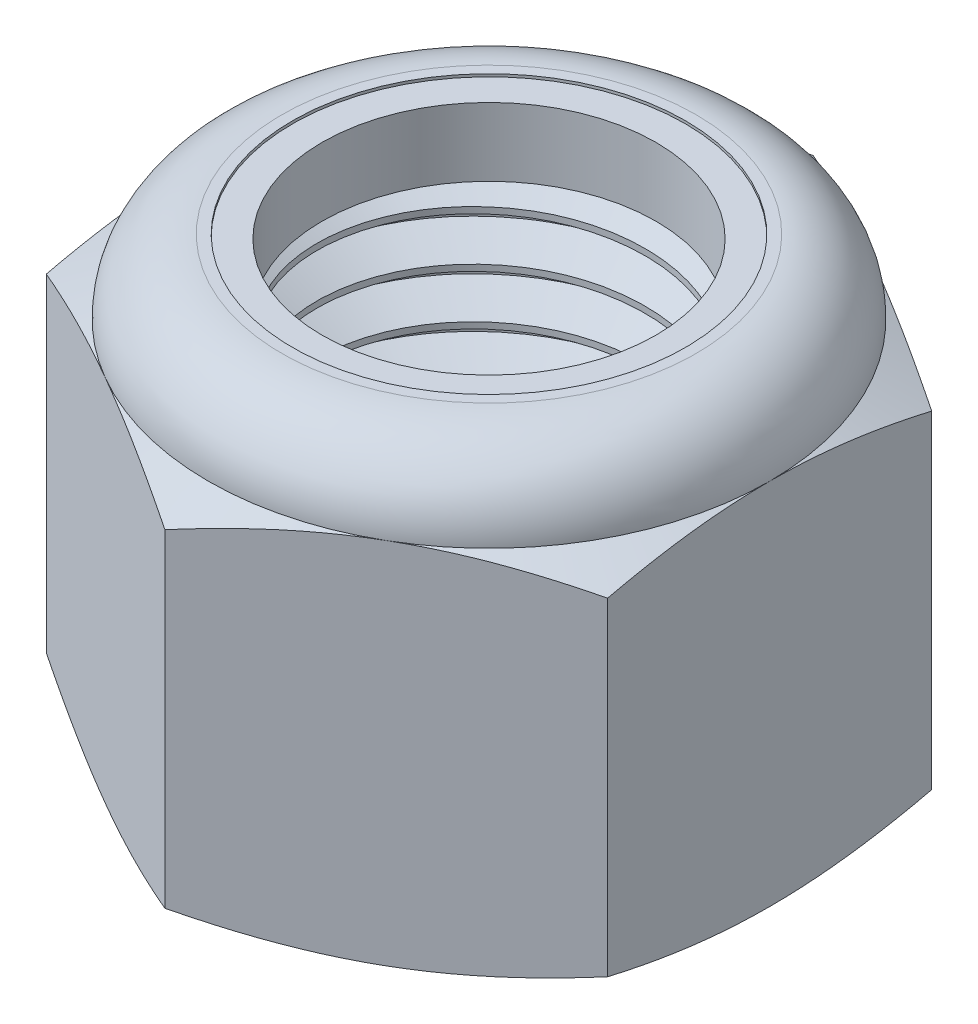
from build123d import *

# Parameters (mm, degrees)
SKETCH1_R        = 11.1125
EXTRUDE1_DEPTH   = 25.003125
SKETCH2_W        = 11.1125
SKETCH2_H        = 20.8359375
CUT_SWEEP1_PITCH = 2.822222222
SKETCH12_W       = 12.22375
SKETCH12_H       = 20.8359375


with BuildPart() as part:
    # Sketch1 → Extrude1 (new body)
    with BuildSketch(Plane(origin=(0, 0, 0), x_dir=(1, 0, 0), z_dir=(0, 1, 0))):
        Polygon((0, 18.330871047), (-15.875, 9.165435523), (-15.875, -9.165435523), (0, -18.330871047), (15.875, -9.165435523), (15.875, 9.165435523), align=None)
        with Locations(Location((0, 0, 0), (0, 0, 90))):
            Circle(SKETCH1_R, mode=Mode.SUBTRACT)
    extrude(amount=EXTRUDE1_DEPTH)

    # Sketch5 → Cut-Revolve3 (revolve, cut)
    with BuildSketch(Plane(origin=(0, 0, 0), x_dir=(0, 0, -1), z_dir=(1, 0, 0))):
        with BuildLine():
            Line((0, 0), (15.875, 0))
            Line((15.875, 0), (18.330871047, 1.145191477))
            Line((18.330871047, 1.145191477), (18.330871047, 19.690746023))
            Line((18.330871047, 19.690746023), (15.875, 20.8359375))
            ThreePointArc((15.875, 20.8359375), (14.65445904, 23.78258404), (11.7078125, 25.003125))
            Line((11.7078125, 25.003125), (11.7078125, 26.273125))
            Line((11.7078125, 26.273125), (19.600871047, 26.273125))
            Line((19.600871047, 26.273125), (19.600871047, -1.27))
            Line((19.600871047, -1.27), (0, -1.27))
            Line((0, -1.27), (0, 0))
        make_face()
    revolve(axis=Axis((0, 0, 0), (0, 1, 0)), mode=Mode.SUBTRACT)

    # Sketch6 → Cut-Revolve4 (revolve, cut)
    with BuildSketch(Plane(origin=(0, 0, 0), x_dir=(0, 0, -1), z_dir=(1, 0, 0))):
        with BuildLine():
            Line((0, 20.8359375), (15.7226, 20.8359375))
            ThreePointArc((15.7226, 20.8359375), (14.546695966, 23.674820966), (11.7078125, 24.850725))
            Line((11.7078125, 24.850725), (5.85390625, 24.850725))
            Line((5.85390625, 24.850725), (5.85390625, 26.273125))
            Line((5.85390625, 26.273125), (0, 26.273125))
            Line((0, 26.273125), (0, 20.8359375))
        make_face()
    revolve(axis=Axis((0, 26.273125, 0), (0, -1, 0)), mode=Mode.SUBTRACT)

    # Sketch4 → Cut-Revolve2 (revolve, cut)
    with BuildSketch(Plane(origin=(0, 0, 0), x_dir=(0, 0, -1), z_dir=(1, 0, 0))):
        Polygon((0, 20.8359375), (12.22375, 20.8359375), (0, 15.135909264), align=None)
        Polygon((0, 5.700028236), (12.22375, 0), (0, 0), align=None)
    revolve(axis=Axis((0, 0, 0), (0, 1, 0)), mode=Mode.SUBTRACT)

    # Sketch12 → Revolve4 (revolve)
    with BuildSketch(Plane(origin=(0, 0, 0), x_dir=(0, 0, -1), z_dir=(1, 0, 0)), mode=Mode.PRIVATE) as revolve4_sk:
        with Locations((6.111875, 10.41796875)):
            Rectangle(SKETCH12_W, SKETCH12_H)
    revolve(revolve4_sk.sketch.rotate(Axis((0, 0, 0), (0, 1, 0)), 180), axis=Axis((0, 0, 0), (0, 1, 0)))


with BuildPart() as body_2:
    # Sketch7 → Revolve2 (revolve)
    with BuildSketch(Plane(origin=(0, 0, 0), x_dir=(0, 0, -1), z_dir=(1, 0, 0))):
        with BuildLine():
            Line((9.445625, 20.9121375), (15.645662809, 20.9121375))
            ThreePointArc((15.645662809, 20.9121375), (14.465742079, 23.647751137), (11.7078125, 24.774525))
            Line((11.7078125, 24.774525), (9.445625, 24.774525))
            Line((9.445625, 24.774525), (9.445625, 20.9121375))
        make_face()
    revolve(axis=Axis((0, 20.9121375, 0), (0, 1, 0)))


with BuildPart() as body_3:
    # Sketch2 → Revolve1 (revolve)
    with BuildSketch(Plane(origin=(0, 0, 0), x_dir=(0, 0, -1), z_dir=(1, 0, 0)), mode=Mode.PRIVATE) as revolve1_sk:
        with Locations((5.55625, 10.41796875)):
            Rectangle(SKETCH2_W, SKETCH2_H)
    revolve(revolve1_sk.sketch.rotate(Axis((0, -11.1125, 0), (0, 1, 0)), 180), axis=Axis((0, -11.1125, 0), (0, 1, 0)))

    # Cut-Sweep1: the profile of Sketch9 screwed along a right-hand helix of 9.859375 turns, 10 arcs to a turn; built about Z, then put on its axis
    cut_sweep1_z = Axis((0, 0, 0), (0, 0, 1))
    cut_sweep1_corners = [(11.418014517, 0, 0.176388889), (11.265257259, 0, -2.557638889), (9.279412895, 0, -1.411111111), (9.279412895, 0, -1.058333333)]
    with BuildLine(mode=Mode.PRIVATE) as cut_sweep1_profile:
        Line(cut_sweep1_corners[0], cut_sweep1_corners[1])
        Line(cut_sweep1_corners[1], cut_sweep1_corners[2])
        Line(cut_sweep1_corners[2], cut_sweep1_corners[3])
        Line(cut_sweep1_corners[3], cut_sweep1_corners[0])
    cut_sweep1_cap = Face(cut_sweep1_profile.wire())
    cut_sweep1_turn_angles = [0, 18, 36, 54, 72, 90, 108, 126, 144, 162, 180, 198, 216, 234, 252, 270, 288, 306, 324, 342, 360]
    cut_sweep1_turn_weights = [1, 0.9510565162951535, 1, 0.9510565162951535, 1, 0.9510565162951535, 1, 0.9510565162951535, 1, 0.9510565162951535, 1, 0.9510565162951535, 1, 0.9510565162951535, 1, 0.9510565162951535, 1, 0.9510565162951535, 1, 0.9510565162951535, 1]
    cut_sweep1_turn_rails = [Edge.make_bspline([Vector(p[0], p[1], 0).rotate(cut_sweep1_z, cut_sweep1_turn_angles[k]) / cut_sweep1_turn_weights[k] + Vector(0, 0, p[2] + CUT_SWEEP1_PITCH * cut_sweep1_turn_angles[k] / 360) for k in range(21)], [0, 0, 0, 1, 1, 2, 2, 3, 3, 4, 4, 5, 5, 6, 6, 7, 7, 8, 8, 9, 9, 10, 10, 10], 2, cut_sweep1_turn_weights) for p in cut_sweep1_corners]
    cut_sweep1_turn_sides = [Face.make_surface_from_curves(cut_sweep1_turn_rails[p[0]], cut_sweep1_turn_rails[p[1]]) for p in [(0, 1), (1, 2), (2, 3), (3, 0)]]
    cut_sweep1_last_angles = [3240, 3258, 3276, 3294, 3312, 3330, 3348, 3366, 3384, 3402, 3420, 3438, 3456, 3474, 3492, 3510, 3528, 3538.6875, 3549.375]
    cut_sweep1_last_weights = [1, 0.9510565162951535, 1, 0.9510565162951535, 1, 0.9510565162951535, 1, 0.9510565162951535, 1, 0.9510565162951535, 1, 0.9510565162951535, 1, 0.9510565162951535, 1, 0.9510565162951535, 1, 0.9826532793307102, 1]
    cut_sweep1_last_rails = [Edge.make_bspline([Vector(p[0], p[1], 0).rotate(cut_sweep1_z, cut_sweep1_last_angles[k]) / cut_sweep1_last_weights[k] + Vector(0, 0, p[2] + CUT_SWEEP1_PITCH * cut_sweep1_last_angles[k] / 360) for k in range(19)], [0, 0, 0, 1, 1, 2, 2, 3, 3, 4, 4, 5, 5, 6, 6, 7, 7, 8, 8, 9, 9, 9], 2, cut_sweep1_last_weights) for p in cut_sweep1_corners]
    cut_sweep1_last_sides = [Face.make_surface_from_curves(cut_sweep1_last_rails[p[0]], cut_sweep1_last_rails[p[1]]) for p in [(0, 1), (1, 2), (2, 3), (3, 0)]]
    cut_sweep1 = Plane(origin=(0, 20.8359375, 0), x_dir=(0, 0, -1), z_dir=(0, -1, 0)) * Solid(Shell([*[p.moved(Location((0, 0, CUT_SWEEP1_PITCH * i))) for i in range(9) for p in cut_sweep1_turn_sides], *cut_sweep1_last_sides, cut_sweep1_cap, cut_sweep1_cap.rotate(cut_sweep1_z, 3549.375).moved(Location((0, 0, CUT_SWEEP1_PITCH * 3549.375 / 360)))]))
    add(cut_sweep1, mode=Mode.SUBTRACT)

    # Sketch11 → Revolve3 (revolve)
    with BuildSketch(Plane(origin=(0, 0, 0), x_dir=(0, 0, -1), z_dir=(1, 0, 0)), mode=Mode.PRIVATE) as revolve3_sk:
        Polygon((0, 0), (12.22375, 0), (0, 5.700028236), align=None)
    revolve(revolve3_sk.sketch.rotate(Axis((0, 25.003125, 0), (0, -1, 0)), 26.603055892), axis=Axis((0, 25.003125, 0), (0, -1, 0)))


with BuildPart() as part_1:
    add(part.part)

    # Combine1: cut body 3
    add(body_3.part, mode=Mode.SUBTRACT)


solid = Compound([body_2.part, part_1.part])
